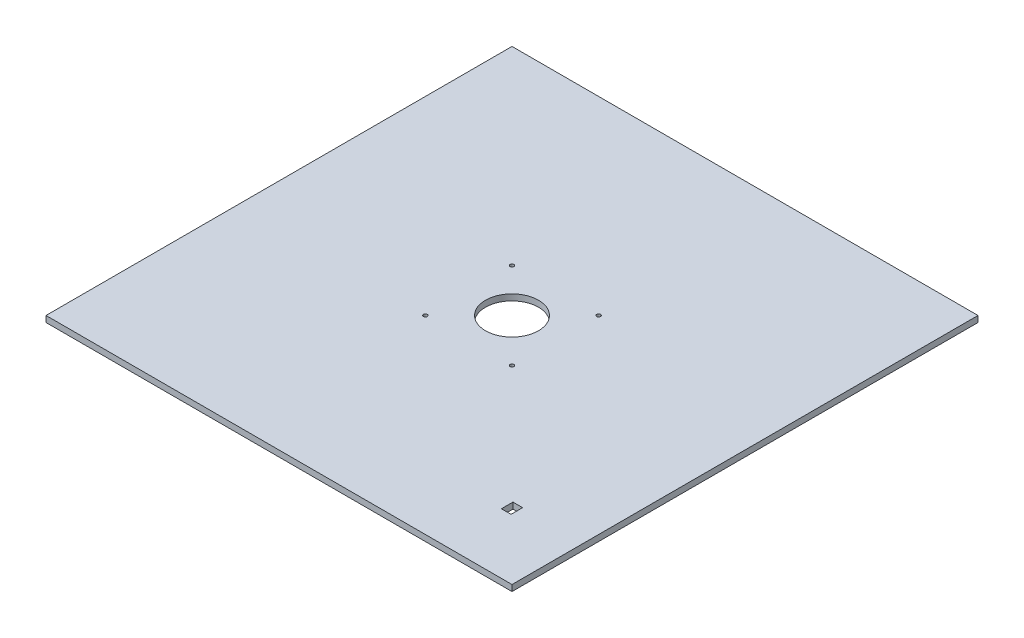
from build123d import *

# Parameters (mm, degrees)
SKETCH1_W               = 482.6
SKETCH1_H               = 482.6
BOSS_EXTRUDE1_DEPTH     = 6.35
CUT_EXTRUDE1_DEPTH      = 342.30880812
CUT_EXTRUDE1_DEPTH_BACK = 342.30880812
SKETCH2_R               = 1.984375
SKETCH2_R_2             = 27.432
SKETCH3_W               = 10
SKETCH3_H               = 12
CUT_EXTRUDE2_DEPTH      = 342.30880812


with BuildPart() as part:
    # Sketch1 → Boss-Extrude1 (new body)
    with BuildSketch(Plane(origin=(0, 0, 0), x_dir=(1, 0, 0), z_dir=(0, 1, 0))):
        Rectangle(SKETCH1_W, SKETCH1_H)
    extrude(amount=BOSS_EXTRUDE1_DEPTH)

    # Sketch2 → Cut-Extrude1 (cut, two sides: drawn at the far end of the back side and taken through both)
    with BuildSketch(Plane(origin=(0, 6.35, 0), x_dir=(1, 0, 0), z_dir=(0, 1, 0)).offset(-CUT_EXTRUDE1_DEPTH_BACK)):
        with Locations((-44.8437, 44.8437)):
            Circle(SKETCH2_R)
        with Locations((44.8437, 44.8437)):
            Circle(SKETCH2_R)
        with Locations((-44.8437, -44.8437)):
            Circle(SKETCH2_R)
        with Locations((44.8437, -44.8437)):
            Circle(SKETCH2_R)
        Circle(SKETCH2_R_2)
    extrude(amount=CUT_EXTRUDE1_DEPTH + CUT_EXTRUDE1_DEPTH_BACK, mode=Mode.SUBTRACT)

    # Sketch3 → Cut-Extrude2 (cut, through all)
    with BuildSketch(Plane(origin=(0, 6.35, 0), x_dir=(1, 0, 0), z_dir=(0, 1, 0))):
        with Locations((172.869930331, -172.869930331)):
            Rectangle(SKETCH3_W, SKETCH3_H)
    extrude(amount=-CUT_EXTRUDE2_DEPTH, mode=Mode.SUBTRACT)


solid = part.part
